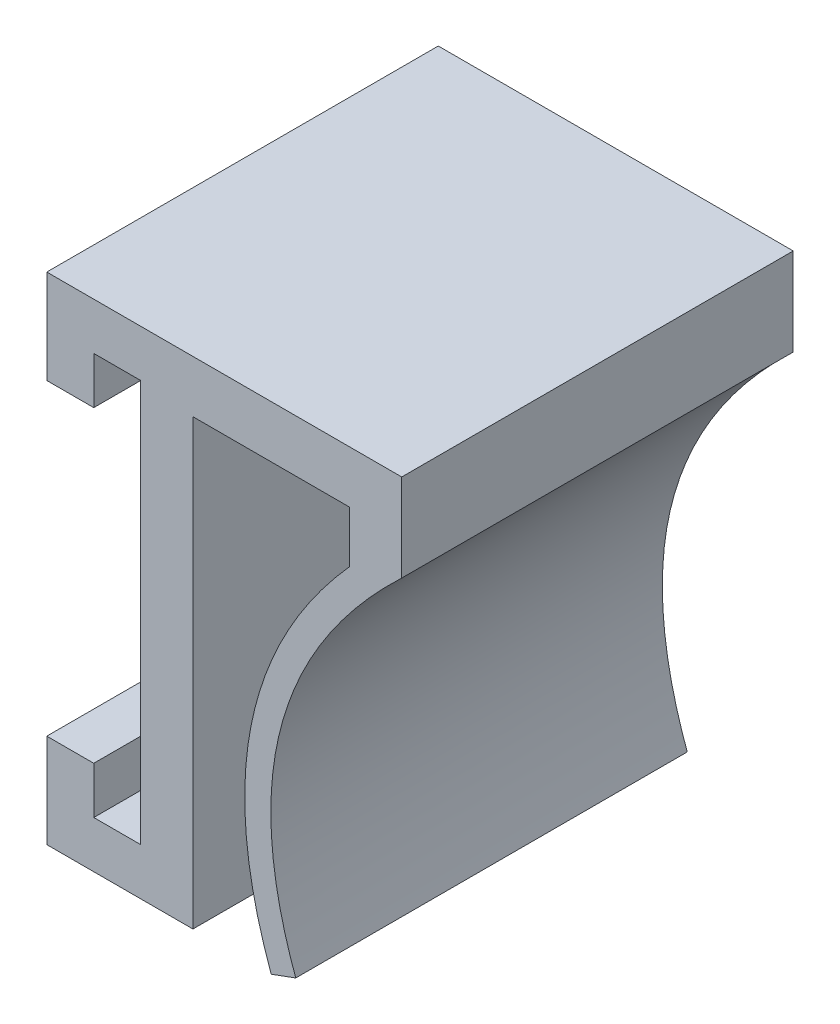
from build123d import *

# Parameters (mm, degrees)
AUFSATZ_LINEAR_AUSTRAGEN1_DEPTH = 15
SKIZZE8_W                       = 15
SKIZZE8_H                       = 1.8
AUFSATZ_LINEAR_AUSTRAGEN2_DEPTH = 3.6
SKIZZE9_W                       = 1.8
SKIZZE9_H                       = 15
AUFSATZ_LINEAR_AUSTRAGEN3_DEPTH = 1.8
SKIZZE10_W                      = 1.8
SKIZZE10_H                      = 15
AUFSATZ_LINEAR_AUSTRAGEN4_DEPTH = 1.8


# Read off the part's stored shape, not the designer's step: Aufsatz-Linear austragen1
with BuildPart() as part:
    # Aufsatz-Linear austragen1 outline → Aufsatz-Linear austragen1 (new body)
    with BuildSketch(Plane.XY):
        with BuildLine():
            Line((7, 7.5), (7, 5.522993755))
            add(Edge.make_bspline(
                [(7, 5.522993755), (0.965861159, -1.223721572), (4, -9.5)],
                knots=[0.129703712, 0.129703712, 0.129703712, 1, 1, 1], degree=2))
            Line((4, -9.5), (4.938894523, -9.155795009))
            add(Edge.make_bspline(
                [(9, 6.145084082), (8.894106899, 6.044673778), (8.472209731, 5.637376992), (7.500876339, 4.623469608), (6.267154764, 3.067786271), (5.159309564, 1.168794415), (4.408096908, -0.769290789), (4.005150376, -2.755259304), (3.945419318, -4.803083613), (4.18652921, -6.57746866), (4.554595844, -8.031875726), (4.803987208, -8.787813624), (4.938894523, -9.155795009)],
                knots=[0.041945828, 0.041945828, 0.041945828, 0.041945828, 0.0625, 0.125, 0.25, 0.375, 0.5, 0.625, 0.75, 0.875, 0.9375, 1, 1, 1, 1], degree=3))
            Line((9, 6.145084082), (9, 9.5))
            Line((9, 9.5), (-1, 9.5))
            Line((-1, 9.5), (-1, -9.5))
            Line((-1, -9.5), (1, -9.5))
            Line((1, -9.5), (1, 7.5))
            Line((1, 7.5), (7, 7.5))
        make_face()
    extrude(amount=AUFSATZ_LINEAR_AUSTRAGEN1_DEPTH)

    # Skizze8 → Aufsatz-Linear austragen2 (add)
    with BuildSketch(Plane.ZY.offset(1)):
        with Locations((7.5, 8.6)):
            Rectangle(SKIZZE8_W, SKIZZE8_H)
        with Locations((7.5, -8.6)):
            Rectangle(SKIZZE8_W, SKIZZE8_H)
    extrude(amount=AUFSATZ_LINEAR_AUSTRAGEN2_DEPTH)

    # Skizze9 → Aufsatz-Linear austragen3 (add)
    with BuildSketch(Plane(origin=(0, -7.7, 0), x_dir=(1, 0, 0), z_dir=(0, 1, 0))):
        with Locations((-3.7, -7.5)):
            Rectangle(SKIZZE9_W, SKIZZE9_H)
    extrude(amount=AUFSATZ_LINEAR_AUSTRAGEN3_DEPTH)

    # Skizze10 → Aufsatz-Linear austragen4 (add)
    with BuildSketch(Plane.XZ.offset(-7.7)):
        with Locations((-3.7, 7.5)):
            Rectangle(SKIZZE10_W, SKIZZE10_H)
    extrude(amount=AUFSATZ_LINEAR_AUSTRAGEN4_DEPTH)


solid = part.part
